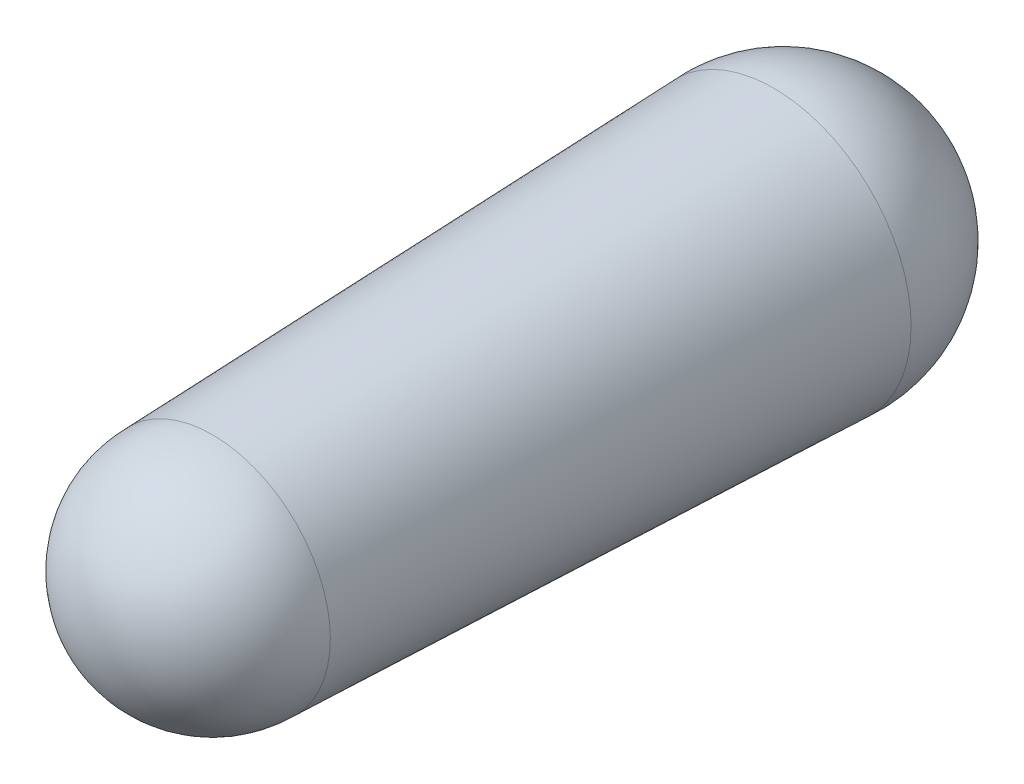
from build123d import *

# Parameters (mm, degrees)
SKETCH2_R           = 1.69
BOSS_EXTRUDE1_DEPTH = 7
BOSS_EXTRUDE1_TAPER = 2


with BuildPart() as part:
    # Sketch1 → Revolve1 (revolve)
    with BuildSketch(Plane.XY):
        with BuildLine():
            Line((0, 1.69), (0, -1.69))
            ThreePointArc((0, -1.69), (1.69, 0), (0, 1.69))
        make_face()
    revolve(axis=Axis((0, 1.69, 0), (0, -1, 0)))

    # Sketch2 → Boss-Extrude1 (add)
    with BuildSketch(Plane.XY):
        Circle(SKETCH2_R)
    extrude(amount=BOSS_EXTRUDE1_DEPTH, taper=BOSS_EXTRUDE1_TAPER)

    # Sketch3 → Revolve2 (revolve)
    with BuildSketch(Plane.XY.offset(7)):
        with BuildLine():
            Line((0, 1.445554614), (0, -1.445554614))
            ThreePointArc((0, -1.445554614), (1.445554614, 0), (0, 1.445554614))
        make_face()
    revolve(axis=Axis((0, 1.445554614, 7), (0, -1, 0)))


solid = part.part
